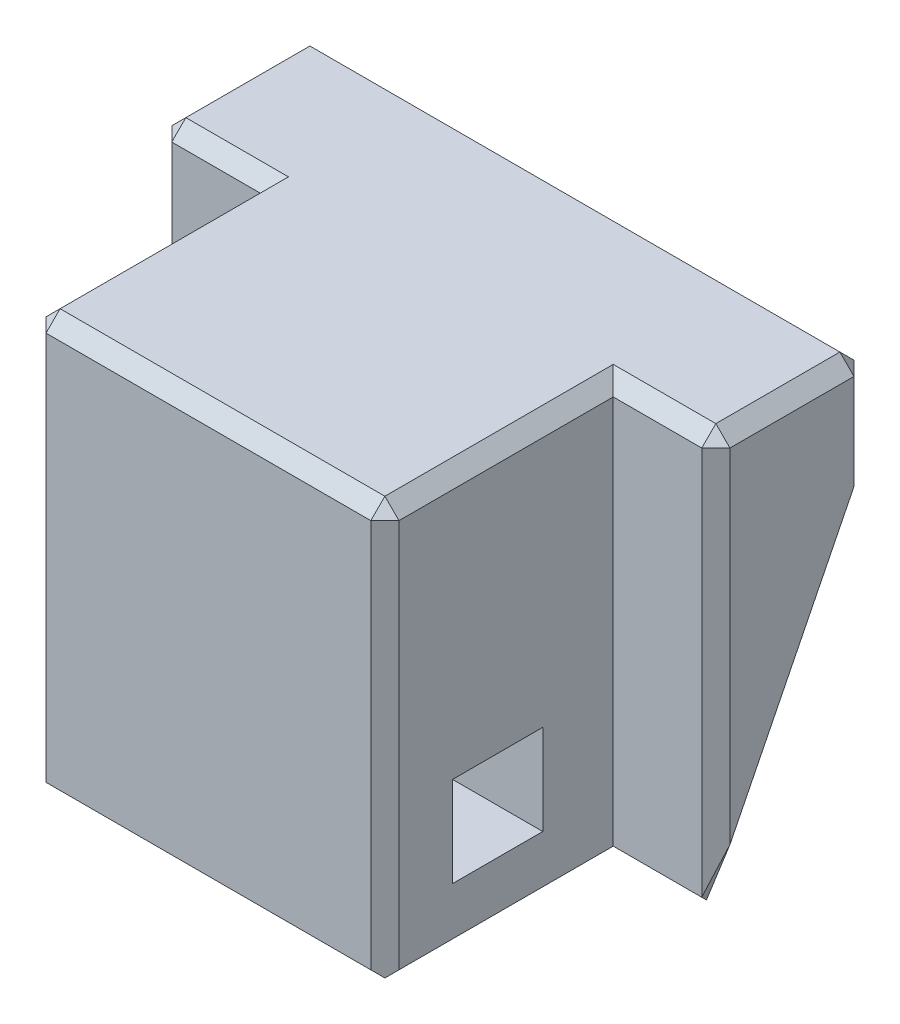
from build123d import *

# Parameters (mm, degrees)
BOSS_EXTRUDE1_DEPTH      = 6.260392
BOSS_EXTRUDE1_DEPTH_BACK = 6.260392
SKETCH4_W                = 8.1
SKETCH4_H                = 14.8
SKETCH4_W_2              = 3.2
SKETCH4_H_2              = 3.2
BOSS_EXTRUDE2_DEPTH      = 9.9
BOSS_EXTRUDE2_DEPTH_BACK = 9.9
CHAMFER2_SIZE            = 0.5


with BuildPart() as part:
    # Sketch4 → Boss-Extrude1 (new, two sides: drawn at the far end of the back side and taken through both)
    with BuildSketch(Plane(origin=(25.940071358, 0, 0), x_dir=(0, 0, -1), z_dir=(1, 0, 0)).offset(-BOSS_EXTRUDE1_DEPTH_BACK)):
        with Locations((-38.743556796, 146.174028513)):
            Rectangle(SKETCH4_W, SKETCH4_H)
        with Locations((-38.793556796, 142.574028513)):
            Rectangle(SKETCH4_W_2, SKETCH4_H_2, mode=Mode.SUBTRACT)
    extrude(amount=BOSS_EXTRUDE1_DEPTH + BOSS_EXTRUDE1_DEPTH_BACK)

    # Sketch4<5> → Boss-Extrude2 (add, two sides: drawn at the far end of the back side and taken through both)
    with BuildSketch(Plane(origin=(25.940071358, 0, 0), x_dir=(0, 0, -1), z_dir=(1, 0, 0)).offset(-BOSS_EXTRUDE2_DEPTH_BACK)):
        Polygon((-34.693556796, 153.574028513), (-34.693556796, 138.774028513), (-29.293556796, 149.574028513), (-29.293556796, 153.574028513), align=None)
    extrude(amount=BOSS_EXTRUDE2_DEPTH + BOSS_EXTRUDE2_DEPTH_BACK)

    # Chamfer1
    # the kernel refuses this chamfer: 0.5, 0.372677996 mm, written as the material it takes off along each edge
    with BuildSketch(Plane(origin=(31.867130024, 153.240695179, 42.460223463), x_dir=(0, 0.7071067811865475, -0.7071067811865475), z_dir=(0.5773502691896258, 0.5773502691896258, 0.5773502691896258)), Plane(origin=(35.506738024, 153.240695179, 34.360223463), x_dir=(0, 0.7071067811865475, -0.7071067811865475), z_dir=(0.5773502691896258, 0.5773502691896258, 0.5773502691896258)), Plane(origin=(16.373404691, 153.240695179, 34.360223463), x_dir=(0, -0.7071067811865475, 0.7071067811865475), z_dir=(-0.5773502691896258, 0.5773502691896258, 0.5773502691896258))) as chamfer1_piece_1:
        Polygon((-0.353553391, 0.204124145), (0.353553391, 0.204124145), (0, -0.40824829), align=None)
    extrude(amount=0.635085296, mode=Mode.SUBTRACT)
    with BuildSketch(Plane(origin=(20.013012691, 153.240695179, 42.460223463), x_dir=(0, 0.7071067811865475, -0.7071067811865475), z_dir=(-0.5773502691896258, 0.5773502691896258, 0.5773502691896258)), Plane(origin=(35.506738024, 153.240695179, 29.62689013), x_dir=(0.7071067811865475, -0.7071067811865475, 0), z_dir=(0.5773502691896258, 0.5773502691896258, -0.5773502691896258)), Plane(origin=(16.373404691, 153.240695179, 29.62689013), x_dir=(0, -0.7071067811865475, -0.7071067811865475), z_dir=(-0.5773502691896258, 0.5773502691896258, -0.5773502691896258))) as chamfer1_piece_2:
        Polygon((-0.353553391, -0.204124145), (0.353553391, -0.204124145), (0, 0.40824829), align=None)
    extrude(amount=0.635085296, mode=Mode.SUBTRACT)
    with BuildSketch(Plane(origin=(35.506738024, 139.75781762, 34.471334574), x_dir=(0, -0.7071067811865777, -0.7071067811865174), z_dir=(0.9485360198619486, -0.223918979794528, 0.22391897979454709))) as chamfer1_piece_3:
        Polygon((0.184955718, -0.526311482), (0.420657979, -0.526311482), (-0.605613697, 1.052622965), align=None)
    extrude(amount=0.64485025, mode=Mode.SUBTRACT)
    with BuildSketch(Plane(origin=(16.373404691, 139.75781762, 34.471334574), x_dir=(0, 0.7071067811865777, 0.7071067811865174), z_dir=(-0.9485360198619486, -0.223918979794528, 0.22391897979454709))) as chamfer1_piece_4:
        Polygon((-0.420657979, -0.526311482), (-0.184955718, -0.526311482), (0.605613697, 1.052622965), align=None)
    extrude(amount=0.64485025, mode=Mode.SUBTRACT)
    with BuildSketch(Plane(origin=(18.393837864, 138.774028513, 42.793556796), x_dir=(0, 0.999621916911297, 0.027495876610582292), z_dir=(1, 0, 0))) as chamfer1_piece_5:
        with BuildLine():
            Line((0.514336598, 0), (-0.028273577, -0.513558897))
            Line((-0.028273577, -0.513558897), (-0.038269797, -0.513283938))
            ThreePointArc((-0.038269797, -0.513283938), (-0.017064614, -0.256698915), (-0.009996219, 0.000274959))
            Line((-0.009996219, 0.000274959), (0.000274959, 0.009996219))
            ThreePointArc((0.000274959, 0.009996219), (0.257248832, 0.002927825), (0.514611556, 0.009996219))
            Line((0.514611556, 0.009996219), (0.514336598, 0))
        make_face()
    extrude(amount=15.092466988, mode=Mode.SUBTRACT)
    with BuildSketch(Plane(origin=(33.486304852, 153.574028513, 42.793556796), x_dir=(0, 0.02749587661058229, -0.9996219169112968), z_dir=(-1, 0, 0))) as chamfer1_piece_6:
        with BuildLine():
            Line((0.514336598, 0), (-0.028273577, 0.513558897))
            Line((-0.028273577, 0.513558897), (-0.038269797, 0.513283938))
            ThreePointArc((-0.038269797, 0.513283938), (-0.017064614, 0.256698915), (-0.009996219, -0.000274959))
            Line((-0.009996219, -0.000274959), (0.000274959, -0.009996219))
            ThreePointArc((0.000274959, -0.009996219), (0.257248832, -0.002927825), (0.514611556, -0.009996219))
            Line((0.514611556, -0.009996219), (0.514336598, 0))
        make_face()
    extrude(amount=15.092466988, mode=Mode.SUBTRACT)
    with BuildSketch(Plane(origin=(32.200463358, 154.859870007, 42.793556796), x_dir=(0.02749587661058229, 0, -0.9996219169112968), z_dir=(0, -1, 0)), Plane(origin=(19.679679358, 154.859870007, 42.793556796), x_dir=(0.999621916911297, 0, 0.027495876610582105), z_dir=(0, -1, 0)), Plane(origin=(16.040071358, 154.859870007, 34.693556796), x_dir=(0.999621916911297, 0, 0.027495876610582105), z_dir=(0, -1, 0))) as chamfer1_piece_7:
        with BuildLine():
            Line((0.514336598, 0), (-0.028273577, -0.513558897))
            Line((-0.028273577, -0.513558897), (-0.038269797, -0.513283938))
            ThreePointArc((-0.038269797, -0.513283938), (-0.017064614, -0.256698915), (-0.009996219, 0.000274959))
            Line((-0.009996219, 0.000274959), (0.000274959, 0.009996219))
            ThreePointArc((0.000274959, 0.009996219), (0.257248832, 0.002927825), (0.514611556, 0.009996219))
            Line((0.514611556, 0.009996219), (0.514336598, 0))
        make_face()
    extrude(amount=17.371682988, mode=Mode.SUBTRACT)
    with BuildSketch(Plane(origin=(32.200463358, 153.574028513, 34.693556796), x_dir=(-0.999621916911297, 0.027495876610582105, 0), z_dir=(0, 0, 1))) as chamfer1_piece_8:
        with BuildLine():
            Line((0.514336598, 0), (-0.028273577, 0.513558897))
            Line((-0.028273577, 0.513558897), (-0.038269797, 0.513283938))
            ThreePointArc((-0.038269797, 0.513283938), (-0.017064614, 0.256698915), (-0.009996219, -0.000274959))
            Line((-0.009996219, -0.000274959), (0.000274959, -0.009996219))
            ThreePointArc((0.000274959, -0.009996219), (0.257248832, -0.002927825), (0.514611556, -0.009996219))
            Line((0.514611556, -0.009996219), (0.514336598, 0))
        make_face()
    extrude(amount=9.385841494, mode=Mode.SUBTRACT)
    with BuildSketch(Plane(origin=(19.679679358, 153.574028513, 34.693556796), x_dir=(0.999621916911297, 0.027495876610582105, 0), z_dir=(0, 0, 1))) as chamfer1_piece_9:
        with BuildLine():
            Line((0.514336598, 0), (-0.028273577, -0.513558897))
            Line((-0.028273577, -0.513558897), (-0.038269797, -0.513283938))
            ThreePointArc((-0.038269797, -0.513283938), (-0.017064614, -0.256698915), (-0.009996219, 0.000274959))
            Line((-0.009996219, 0.000274959), (0.000274959, 0.009996219))
            ThreePointArc((0.000274959, 0.009996219), (0.257248832, 0.002927825), (0.514611556, 0.009996219))
            Line((0.514611556, 0.009996219), (0.514336598, 0))
        make_face()
    extrude(amount=9.385841494, mode=Mode.SUBTRACT)
    with BuildSketch(Plane(origin=(37.125912852, 153.574028513, 34.693556796), x_dir=(0, -0.999621916911297, 0.027495876610582292), z_dir=(-1, 0, 0))) as chamfer1_piece_10:
        with BuildLine():
            Line((0.514336598, 0), (-0.028273577, -0.513558897))
            Line((-0.028273577, -0.513558897), (-0.038269797, -0.513283938))
            ThreePointArc((-0.038269797, -0.513283938), (-0.017064614, -0.256698915), (-0.009996219, 0.000274959))
            Line((-0.009996219, 0.000274959), (0.000274959, 0.009996219))
            ThreePointArc((0.000274959, 0.009996219), (0.257248832, 0.002927825), (0.514611556, 0.009996219))
            Line((0.514611556, 0.009996219), (0.514336598, 0))
        make_face()
    extrude(amount=4.925449494, mode=Mode.SUBTRACT)
    with BuildSketch(Plane(origin=(35.840071358, 153.574028513, 28.007715302), x_dir=(-0.999621916911297, 0.027495876610582292, 0), z_dir=(0, 0, 1))) as chamfer1_piece_11:
        with BuildLine():
            Line((0.514336598, 0), (-0.028273577, 0.513558897))
            Line((-0.028273577, 0.513558897), (-0.038269797, 0.513283938))
            ThreePointArc((-0.038269797, 0.513283938), (-0.017064614, 0.256698915), (-0.009996219, -0.000274959))
            Line((-0.009996219, -0.000274959), (0.000274959, -0.009996219))
            ThreePointArc((0.000274959, -0.009996219), (0.257248832, -0.002927825), (0.514611556, -0.009996219))
            Line((0.514611556, -0.009996219), (0.514336598, 0))
        make_face()
    extrude(amount=7.971682988, mode=Mode.SUBTRACT)
    with BuildSketch(Plane(origin=(37.125912852, 153.574028513, 29.293556796), x_dir=(0, 0.027495876610582105, 0.999621916911297), z_dir=(-1, 0, 0))) as chamfer1_piece_12:
        with BuildLine():
            Line((0.514336598, 0), (-0.028273577, -0.513558897))
            Line((-0.028273577, -0.513558897), (-0.038269797, -0.513283938))
            ThreePointArc((-0.038269797, -0.513283938), (-0.017064614, -0.256698915), (-0.009996219, 0.000274959))
            Line((-0.009996219, 0.000274959), (0.000274959, 0.009996219))
            ThreePointArc((0.000274959, 0.009996219), (0.257248832, 0.002927825), (0.514611556, 0.009996219))
            Line((0.514611556, 0.009996219), (0.514336598, 0))
        make_face()
    extrude(amount=22.371682988, mode=Mode.SUBTRACT)
    with BuildSketch(Plane(origin=(16.040071358, 153.574028513, 28.007715302), x_dir=(0.999621916911297, 0.027495876610582105, 0), z_dir=(0, 0, 1))) as chamfer1_piece_13:
        with BuildLine():
            Line((0.514336598, 0), (-0.028273577, -0.513558897))
            Line((-0.028273577, -0.513558897), (-0.038269797, -0.513283938))
            ThreePointArc((-0.038269797, -0.513283938), (-0.017064614, -0.256698915), (-0.009996219, 0.000274959))
            Line((-0.009996219, 0.000274959), (0.000274959, 0.009996219))
            ThreePointArc((0.000274959, 0.009996219), (0.257248832, 0.002927825), (0.514611556, 0.009996219))
            Line((0.514611556, 0.009996219), (0.514336598, 0))
        make_face()
    extrude(amount=7.971682988, mode=Mode.SUBTRACT)
    with BuildSketch(Plane(origin=(35.840071358, 148.288187019, 29.293556796), x_dir=(0.027495876610582105, 0, 0.999621916911297), z_dir=(0, 1, 0)), Plane(origin=(16.040071358, 148.288187019, 29.293556796), x_dir=(0.9996219169112968, 0, -0.027495876610589005), z_dir=(0, 1, 0))) as chamfer1_piece_14:
        with BuildLine():
            Line((0.514336598, 0), (-0.028273577, -0.513558897))
            Line((-0.028273577, -0.513558897), (-0.038269797, -0.513283938))
            ThreePointArc((-0.038269797, -0.513283938), (-0.017064614, -0.256698915), (-0.009996219, 0.000274959))
            Line((-0.009996219, 0.000274959), (0.000274959, 0.009996219))
            ThreePointArc((0.000274959, 0.009996219), (0.257248832, 0.002927825), (0.514611556, 0.009996219))
            Line((0.514611556, 0.009996219), (0.514336598, 0))
        make_face()
    extrude(amount=6.571682988, mode=Mode.SUBTRACT)
    with BuildSketch(Plane(origin=(35.840071358, 137.623936917, 35.268602594), x_dir=(-0.999621916911297, -0.012296529840442863, -0.024593059680883298), z_dir=(0, 0.8944271909998982, -0.44721359549999323))) as chamfer1_piece_15:
        with BuildLine():
            Line((0.514336598, 0), (-0.028273577, 0.513558897))
            Line((-0.028273577, 0.513558897), (-0.038269797, 0.513283938))
            ThreePointArc((-0.038269797, 0.513283938), (-0.017064614, 0.256698915), (-0.009996219, -0.000274959))
            Line((-0.009996219, -0.000274959), (0.000274959, -0.009996219))
            ThreePointArc((0.000274959, -0.009996219), (0.257248832, -0.002927825), (0.514611556, -0.009996219))
            Line((0.514611556, -0.009996219), (0.514336598, 0))
        make_face()
    extrude(amount=14.646450066, mode=Mode.SUBTRACT)
    with BuildSketch(Plane(origin=(16.040071358, 137.623936917, 35.268602594), x_dir=(0.999621916911297, -0.012296529840442778, -0.024593059680883128), z_dir=(0, 0.8944271909998982, -0.44721359549999323))) as chamfer1_piece_16:
        with BuildLine():
            Line((0.514336598, 0), (-0.028273577, -0.513558897))
            Line((-0.028273577, -0.513558897), (-0.038269797, -0.513283938))
            ThreePointArc((-0.038269797, -0.513283938), (-0.017064614, -0.256698915), (-0.009996219, 0.000274959))
            Line((-0.009996219, 0.000274959), (0.000274959, 0.009996219))
            ThreePointArc((0.000274959, 0.009996219), (0.257248832, 0.002927825), (0.514611556, 0.009996219))
            Line((0.514611556, 0.009996219), (0.514336598, 0))
        make_face()
    extrude(amount=14.646450066, mode=Mode.SUBTRACT)
    with BuildSketch(Plane(origin=(19.679679358, 153.574028513, 34.693556796), x_dir=(0, 0.02749587661058229, -0.9996219169112968), z_dir=(-1, 0, 0))) as chamfer1_piece_17:
        with BuildLine():
            Line((0.514336598, 0), (-0.028273577, 0.513558897))
            Line((-0.028273577, 0.513558897), (-0.038269797, 0.513283938))
            ThreePointArc((-0.038269797, 0.513283938), (-0.017064614, 0.256698915), (-0.009996219, -0.000274959))
            Line((-0.009996219, -0.000274959), (0.000274959, -0.009996219))
            ThreePointArc((0.000274959, -0.009996219), (0.257248832, -0.002927825), (0.514611556, -0.009996219))
            Line((0.514611556, -0.009996219), (0.514336598, 0))
        make_face()
    extrude(amount=4.925449494, mode=Mode.SUBTRACT)
    with BuildSketch(Plane(origin=(35.840071358, 154.859870007, 34.693556796), x_dir=(-0.999621916911297, 0, 0.027495876610582292), z_dir=(0, -1, 0))) as chamfer1_piece_18:
        with BuildLine():
            Line((0.514336598, 0), (-0.028273577, 0.513558897))
            Line((-0.028273577, 0.513558897), (-0.038269797, 0.513283938))
            ThreePointArc((-0.038269797, 0.513283938), (-0.017064614, 0.256698915), (-0.009996219, -0.000274959))
            Line((-0.009996219, -0.000274959), (0.000274959, -0.009996219))
            ThreePointArc((0.000274959, -0.009996219), (0.257248832, -0.002927825), (0.514611556, -0.009996219))
            Line((0.514611556, -0.009996219), (0.514336598, 0))
        make_face()
    extrude(amount=17.371682988, mode=Mode.SUBTRACT)
    with BuildSketch(Plane(origin=(32.200463358, 138.774028513, 34.693556796), x_dir=(0, 0.999621916911297, 0.027495876610582292), z_dir=(1, 0, 0))) as chamfer1_piece_19:
        with BuildLine():
            Line((0.514336598, 0), (0.31409902, -0.189516883))
            Line((0.31409902, -0.189516883), (0.309382645, -0.198334808))
            ThreePointArc((0.309382645, -0.198334808), (0.156807481, -0.095210948), (-0.004716376, -0.008817925))
            Line((-0.004716376, -0.008817925), (0.000274959, 0.009996219))
            ThreePointArc((0.000274959, 0.009996219), (0.257248832, 0.002927825), (0.514611556, 0.009996219))
            Line((0.514611556, 0.009996219), (0.514336598, 0))
        make_face()
    extrude(amount=4.925449494, mode=Mode.SUBTRACT)
    with BuildSketch(Plane(origin=(14.754229864, 138.774028513, 34.693556796), x_dir=(0, 0.8700995906888151, -0.492875950197569), z_dir=(1, 0, 0))) as chamfer1_piece_20:
        with BuildLine():
            Line((0.366844441, 0), (0.440384543, 0.26571336))
            Line((0.440384543, 0.26571336), (0.435455784, 0.274414356))
            ThreePointArc((0.435455784, 0.274414356), (0.218748671, 0.135405143), (-0.00492876, 0.008700996))
            Line((-0.00492876, 0.008700996), (0.000517213, -0.009986616))
            ThreePointArc((0.000517213, -0.009986616), (0.183448762, -0.00051248), (0.367361654, -0.009986616))
            Line((0.367361654, -0.009986616), (0.366844441, 0))
        make_face()
    extrude(amount=4.925449494, mode=Mode.SUBTRACT)
    with BuildSketch(Plane(origin=(37.125912852, 153.574028513, 34.693556796), x_dir=(0, -0.999621916911297, 0.027495876610582292), z_dir=(-1, 0, 0))) as chamfer1_piece_21a_section:
        with BuildLine():
            Line((0.514336598, 0), (-0.028273577, -0.513558897))
            Line((-0.028273577, -0.513558897), (-0.038269797, -0.513283938))
            ThreePointArc((-0.038269797, -0.513283938), (-0.017064614, -0.256698915), (-0.009996219, 0.000274959))
            Line((-0.009996219, 0.000274959), (0.000274959, 0.009996219))
            ThreePointArc((0.000274959, 0.009996219), (0.257248832, 0.002927825), (0.514611556, 0.009996219))
            Line((0.514611556, 0.009996219), (0.514336598, 0))
        make_face()
    chamfer1_piece_21a = extrude(amount=6.211290988, mode=Mode.PRIVATE)
    chamfer1_piece_21a = split(chamfer1_piece_21a, bisect_by=Plane(origin=(32.200463358, 153.409131699, 34.528659983), z_dir=(-1, 0, 0)), keep=Keep.TOP, mode=Mode.PRIVATE)
    with BuildSketch(Plane(origin=(32.200463358, 153.574028513, 33.407715302), x_dir=(-0.999621916911297, 0.027495876610582105, 0), z_dir=(0, 0, 1))) as chamfer1_piece_21b_section:
        with BuildLine():
            Line((0.514336598, 0), (-0.028273577, 0.513558897))
            Line((-0.028273577, 0.513558897), (-0.038269797, 0.513283938))
            ThreePointArc((-0.038269797, 0.513283938), (-0.017064614, 0.256698915), (-0.009996219, -0.000274959))
            Line((-0.009996219, -0.000274959), (0.000274959, -0.009996219))
            ThreePointArc((0.000274959, -0.009996219), (0.257248832, -0.002927825), (0.514611556, -0.009996219))
            Line((0.514611556, -0.009996219), (0.514336598, 0))
        make_face()
    chamfer1_piece_21b = extrude(amount=10.671682988, mode=Mode.PRIVATE)
    chamfer1_piece_21b = split(chamfer1_piece_21b, bisect_by=Plane(origin=(32.035566544, 153.409131699, 34.693556796), z_dir=(0, 0, -1)), keep=Keep.TOP, mode=Mode.PRIVATE)
    chamfer1_piece_21 = chamfer1_piece_21a & chamfer1_piece_21b
    add(chamfer1_piece_21, mode=Mode.SUBTRACT)
    with BuildSketch(Plane(origin=(19.679679358, 153.574028513, 33.407715302), x_dir=(0.999621916911297, 0.027495876610582105, 0), z_dir=(0, 0, 1))) as chamfer1_piece_22a_section:
        with BuildLine():
            Line((0.514336598, 0), (-0.028273577, -0.513558897))
            Line((-0.028273577, -0.513558897), (-0.038269797, -0.513283938))
            ThreePointArc((-0.038269797, -0.513283938), (-0.017064614, -0.256698915), (-0.009996219, 0.000274959))
            Line((-0.009996219, 0.000274959), (0.000274959, 0.009996219))
            ThreePointArc((0.000274959, 0.009996219), (0.257248832, 0.002927825), (0.514611556, 0.009996219))
            Line((0.514611556, 0.009996219), (0.514336598, 0))
        make_face()
    chamfer1_piece_22a = extrude(amount=10.671682988, mode=Mode.PRIVATE)
    chamfer1_piece_22a = split(chamfer1_piece_22a, bisect_by=Plane(origin=(19.844576171, 153.409131699, 34.693556796), z_dir=(0, 0, -1)), keep=Keep.TOP, mode=Mode.PRIVATE)
    with BuildSketch(Plane(origin=(20.965520852, 153.574028513, 34.693556796), x_dir=(0, 0.02749587661058229, -0.9996219169112968), z_dir=(-1, 0, 0))) as chamfer1_piece_22b_section:
        with BuildLine():
            Line((0.514336598, 0), (-0.028273577, 0.513558897))
            Line((-0.028273577, 0.513558897), (-0.038269797, 0.513283938))
            ThreePointArc((-0.038269797, 0.513283938), (-0.017064614, 0.256698915), (-0.009996219, -0.000274959))
            Line((-0.009996219, -0.000274959), (0.000274959, -0.009996219))
            ThreePointArc((0.000274959, -0.009996219), (0.257248832, -0.002927825), (0.514611556, -0.009996219))
            Line((0.514611556, -0.009996219), (0.514336598, 0))
        make_face()
    chamfer1_piece_22b = extrude(amount=6.211290988, mode=Mode.PRIVATE)
    chamfer1_piece_22b = split(chamfer1_piece_22b, bisect_by=Plane(origin=(19.679679358, 153.409131699, 34.528659983), z_dir=(1, 0, 0)), keep=Keep.TOP, mode=Mode.PRIVATE)
    chamfer1_piece_22 = chamfer1_piece_22a & chamfer1_piece_22b
    add(chamfer1_piece_22, mode=Mode.SUBTRACT)

    # Chamfer2
    chamfer2_edges = [part.edges().sort_by_distance(p)[0] for p in [
        (32.200463358, 138.774028513, 38.493556796),
        (19.679679358, 138.774028513, 38.493556796),
    ]]
    chamfer(chamfer2_edges, length=CHAMFER2_SIZE)


solid = part.part
